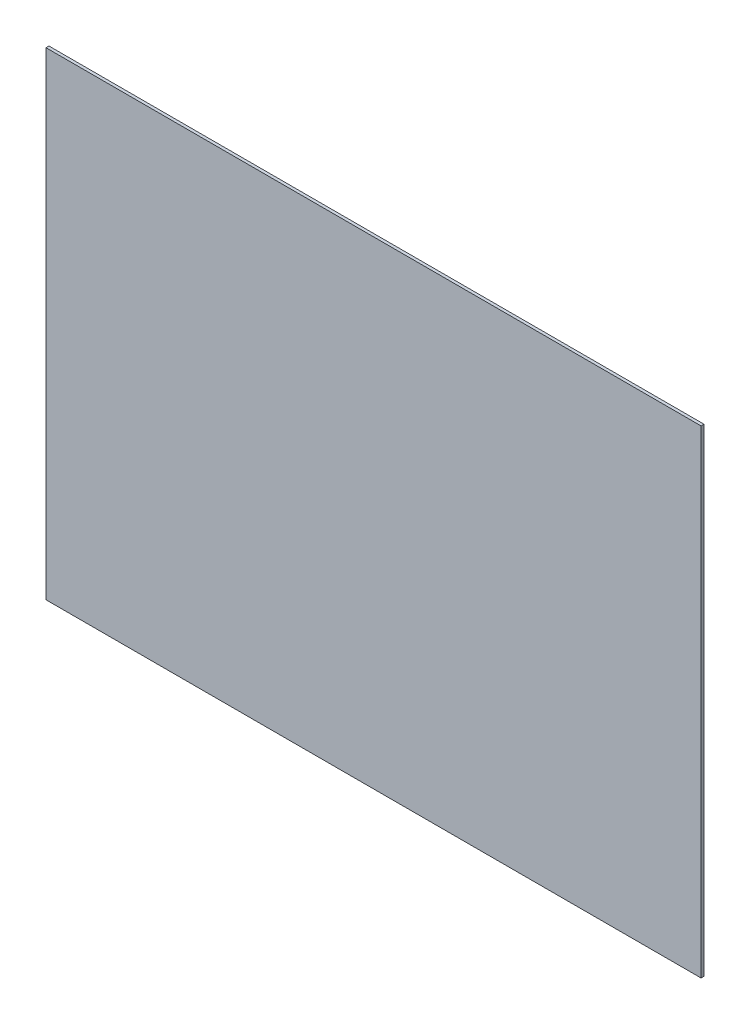
from build123d import *

# Parameters (mm, degrees)
SKETCH2_W           = 450.48
SKETCH2_H           = 328.82
BOSS_EXTRUDE1_DEPTH = 2.032


with BuildPart() as part:
    # Sketch2 → Boss-Extrude1 (new body)
    with BuildSketch(Plane.XY):
        Rectangle(SKETCH2_W, SKETCH2_H)
    extrude(amount=BOSS_EXTRUDE1_DEPTH)


solid = part.part
